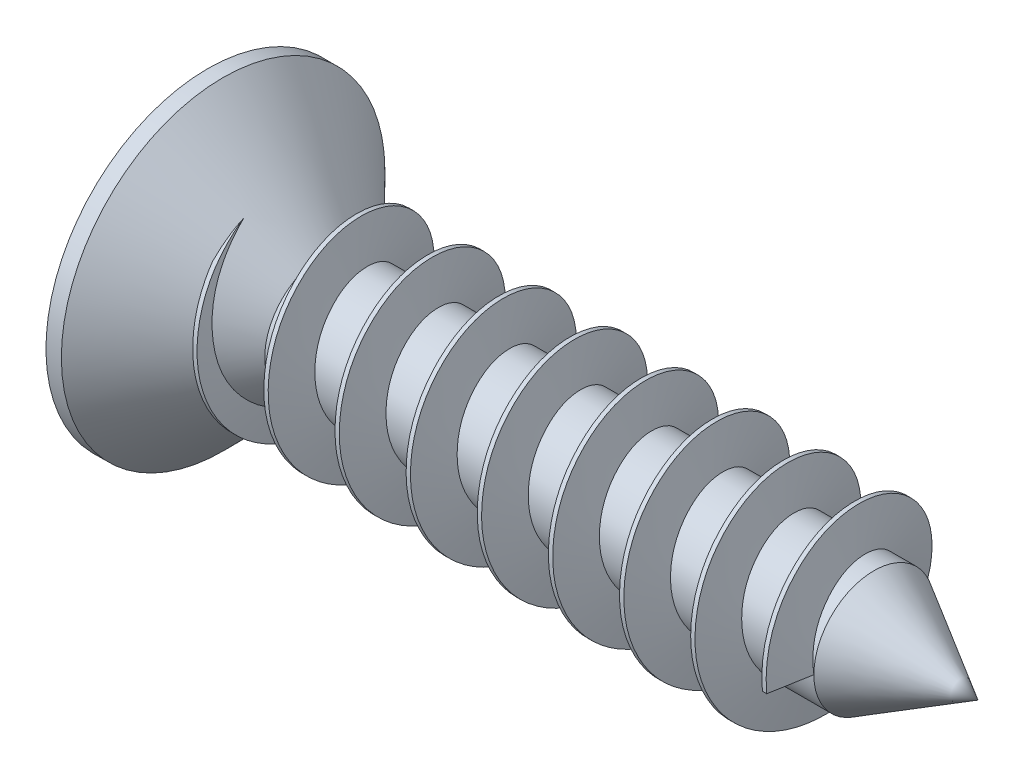
from build123d import *

# Parameters (mm, degrees)
THREAD_PITCH                    = 0.923510064
SKETCH5_W                       = 2.6
SKETCH5_H                       = 0.6
CROSSSCREWDRIVE_DEPTH           = 1
CROSSSCREWDRIVE_DRAFT           = -10
SKETCH5_W_2                     = 0.6
SKETCH5_H_2                     = 2.6
CROSSSCREWDRIVE_PROFILE_2_DEPTH = 1
CROSSSCREWDRIVE_PROFILE_2_DRAFT = -10


with BuildPart() as part:
    # Sketch1 → Body (revolve)
    with BuildSketch(Plane.XY):
        Polygon((0, 0), (0, 2.1), (0.2, 2.1), (1.52, 0.78), (8.64900037, 0.78), (10, 0), align=None)
    revolve(axis=Axis((10, 0, 0), (-1, 0, 0)))

    # Thread: the profile of Thread Profile1 profile screwed along a right-hand helix of 8.282531 turns, 8 arcs to a turn; built about Z, then put on its axis
    thread_z = Axis((0, 0, 0), (0, 0, 1))
    thread_corners = [(0.7797, 0, -5.2898e-05), (1.3, 0, 0.09169003), (1.3, 0, 0.14794003), (0.7797, 0, 0.239682958)]
    with BuildLine(mode=Mode.PRIVATE) as thread_profile:
        Line(thread_corners[0], thread_corners[1])
        Line(thread_corners[1], thread_corners[2])
        Line(thread_corners[2], thread_corners[3])
        Line(thread_corners[3], thread_corners[0])
    thread_cap = Face(thread_profile.wire())
    thread_turn_angles = [0, 22.5, 45, 67.5, 90, 112.5, 135, 157.5, 180, 202.5, 225, 247.5, 270, 292.5, 315, 337.5, 360]
    thread_turn_weights = [1, 0.9238795325112867, 1, 0.9238795325112867, 1, 0.9238795325112867, 1, 0.9238795325112867, 1, 0.9238795325112867, 1, 0.9238795325112867, 1, 0.9238795325112867, 1, 0.9238795325112867, 1]
    thread_turn_rails = [Edge.make_bspline([Vector(p[0], p[1], 0).rotate(thread_z, thread_turn_angles[k]) / thread_turn_weights[k] + Vector(0, 0, p[2] + THREAD_PITCH * thread_turn_angles[k] / 360) for k in range(17)], [0, 0, 0, 1, 1, 2, 2, 3, 3, 4, 4, 5, 5, 6, 6, 7, 7, 8, 8, 8], 2, thread_turn_weights) for p in thread_corners]
    thread_turn_sides = [Face.make_surface_from_curves(thread_turn_rails[p[0]], thread_turn_rails[p[1]]) for p in [(0, 1), (1, 2), (2, 3), (3, 0)]]
    thread_last_angles = [2880, 2902.5, 2925, 2947.5, 2970, 2975.855508397, 2981.711016794]
    thread_last_weights = [1, 0.9238795325112867, 1, 0.9238795325112867, 1, 0.9947823381817135, 1]
    thread_last_rails = [Edge.make_bspline([Vector(p[0], p[1], 0).rotate(thread_z, thread_last_angles[k]) / thread_last_weights[k] + Vector(0, 0, p[2] + THREAD_PITCH * thread_last_angles[k] / 360) for k in range(7)], [0, 0, 0, 1, 1, 2, 2, 3, 3, 3], 2, thread_last_weights) for p in thread_corners]
    thread_last_sides = [Face.make_surface_from_curves(thread_last_rails[p[0]], thread_last_rails[p[1]]) for p in [(0, 1), (1, 2), (2, 3), (3, 0)]]
    thread = Plane(origin=(8.64900037, 0, 0), x_dir=(0, 0, 1), z_dir=(-1, 0, 0)) * Solid(Shell([*[p.moved(Location((0, 0, THREAD_PITCH * i))) for i in range(8) for p in thread_turn_sides], *thread_last_sides, thread_cap, thread_cap.rotate(thread_z, 2981.711016794).moved(Location((0, 0, THREAD_PITCH * 2981.711016794 / 360)))]))
    add(thread)


with BuildPart() as crossscrewdrive_tool:
    # Sketch5 → CrossScrewDrive (with draft: the straight prism first)
    with BuildSketch(Plane.ZY):
        Rectangle(SKETCH5_W, SKETCH5_H)
    extrude(amount=-CROSSSCREWDRIVE_DEPTH)
    # CrossScrewDrive: the draft: its side faces are tilted about the plane it starts from
    crossscrewdrive_sides = [crossscrewdrive_tool.faces().sort_by_distance(p)[0] for p in [
        (0.5, -0.3, 0),
        (0.5, 0, 1.3),
        (0.5, 0.3, 0),
        (0.5, 0, -1.3),
    ]]
    draft(crossscrewdrive_sides, Plane.ZY, CROSSSCREWDRIVE_DRAFT)


with BuildPart() as part_1:
    add(part.part)

    # CrossScrewDrive: cut by crossscrewdrive_tool
    add(crossscrewdrive_tool.part, mode=Mode.SUBTRACT)


with BuildPart() as crossscrewdrive_profile_2_tool:
    # Sketch5 → CrossScrewDrive profile 2 (with draft: the straight prism first)
    with BuildSketch(Plane.ZY):
        Rectangle(SKETCH5_W_2, SKETCH5_H_2)
    extrude(amount=-CROSSSCREWDRIVE_PROFILE_2_DEPTH)
    # CrossScrewDrive profile 2: the draft: its side faces are tilted about the plane it starts from
    crossscrewdrive_profile_2_sides = [crossscrewdrive_profile_2_tool.faces().sort_by_distance(p)[0] for p in [
        (0.5, 0, -0.3),
        (0.5, -1.3, 0),
        (0.5, 0, 0.3),
        (0.5, 1.3, 0),
    ]]
    draft(crossscrewdrive_profile_2_sides, Plane.ZY, CROSSSCREWDRIVE_PROFILE_2_DRAFT)


with BuildPart() as part_2:
    add(part_1.part)

    # CrossScrewDrive profile 2: cut by crossscrewdrive_profile_2_tool
    add(crossscrewdrive_profile_2_tool.part, mode=Mode.SUBTRACT)


solid = part_2.part
